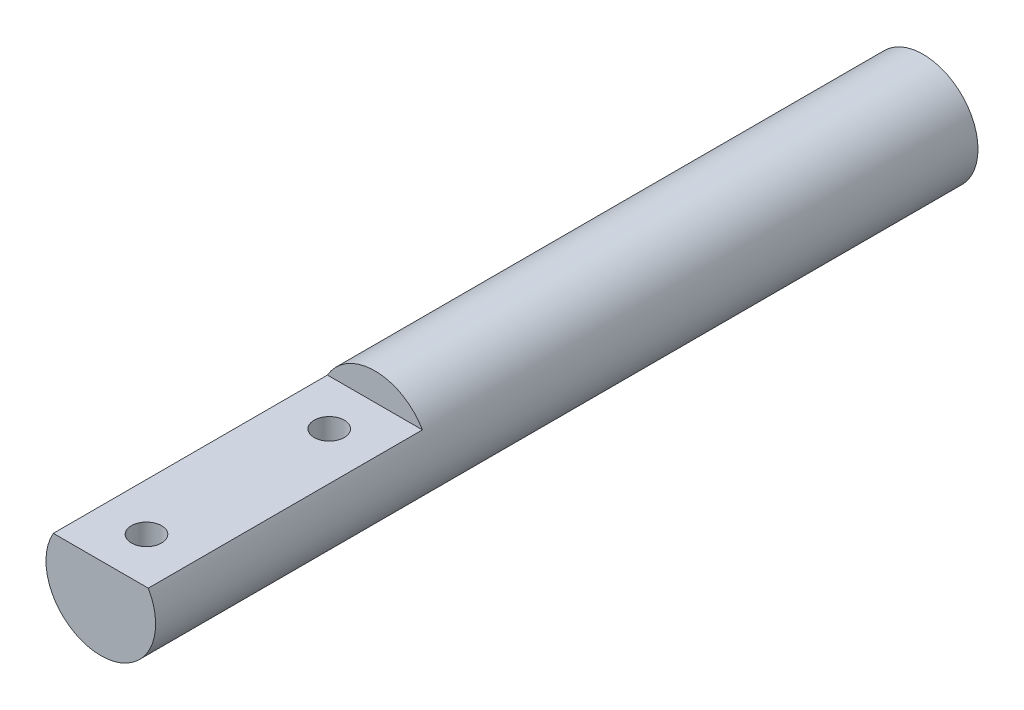
from build123d import *

# Parameters (mm, degrees)
ESQUISSE1_R             = 6
BOSS_EXTRU_1_DEPTH      = 90
ESQUISSE2_W             = 10.392304846
ESQUISSE2_H             = 6
ENL_V_MAT_EXTRU_1_DEPTH = 30
ESQUISSE3_R             = 1.65
ENL_V_MAT_EXTRU_2_DEPTH = 91.647669578


with BuildPart() as part:
    # Esquisse1 → Boss.-Extru.1 (new body)
    with BuildSketch(Plane.XY):
        Circle(ESQUISSE1_R)
    extrude(amount=BOSS_EXTRU_1_DEPTH)

    # Esquisse2 → Enlèv. mat.-Extru.1 (cut)
    with BuildSketch(Plane.XY.offset(90)):
        with Locations((0, 6)):
            Rectangle(ESQUISSE2_W, ESQUISSE2_H)
    extrude(amount=-ENL_V_MAT_EXTRU_1_DEPTH, mode=Mode.SUBTRACT)

    # Esquisse3 → Enlèv. mat.-Extru.2 (cut, through all)
    with BuildSketch(Plane(origin=(0, 3, 0), x_dir=(1, 0, 0), z_dir=(0, 1, 0))):
        with Locations((0, -85)):
            Circle(ESQUISSE3_R)
        with Locations((0, -65)):
            Circle(ESQUISSE3_R)
    extrude(amount=-ENL_V_MAT_EXTRU_2_DEPTH, mode=Mode.SUBTRACT)


solid = part.part
